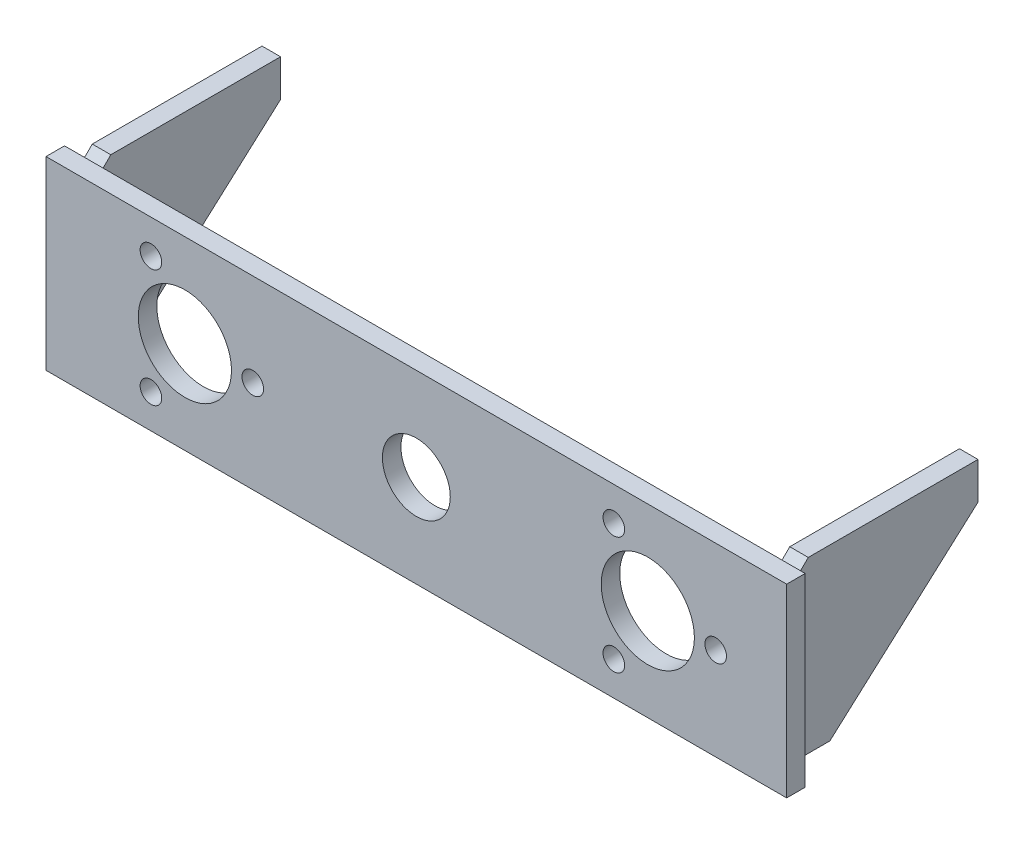
from build123d import *

# Parameters (mm, degrees)
SKETCH1_W          = 240
SKETCH1_H          = 60
BASE_FLANGE1_DEPTH = 6
BASE_FLANGE2_DEPTH = 6
BASE_FLANGE3_DEPTH = 6
SKETCH12_R         = 11
CUT_EXTRUDE1_DEPTH = 141.199857347
SKETCH13_R         = 15.1
CUT_EXTRUDE2_DEPTH = 141.199857347
SKETCH14_R         = 3.5
CUT_EXTRUDE3_DEPTH = 138.477270849
CIRPATTERN1_COUNT  = 3
SKETCH15_R         = 3.5
CUT_EXTRUDE4_DEPTH = 138.477270849
CIRPATTERN2_COUNT  = 3


# Sheet-metal steps are written as plain solids
with BuildPart() as part:
    # Sketch1 → Base-Flange1 (new body)
    with BuildSketch(Plane.XY):
        Rectangle(SKETCH1_W, SKETCH1_H)
    extrude(amount=-BASE_FLANGE1_DEPTH)

    # Sketch12 → Cut-Extrude1 (cut, through all)
    with BuildSketch(Plane.XY):
        Circle(SKETCH12_R)
    extrude(amount=-CUT_EXTRUDE1_DEPTH, mode=Mode.SUBTRACT)

    # Sketch13 → Cut-Extrude2 (cut, through all)
    with BuildSketch(Plane.XY):
        with Locations((-75, 0)):
            Circle(SKETCH13_R)
        with Locations((75, 0)):
            Circle(SKETCH13_R)
    extrude(amount=-CUT_EXTRUDE2_DEPTH, mode=Mode.SUBTRACT)

    # Sketch14 → Cut-Extrude3 (cut, through all)
    with BuildSketch(Plane(origin=(0, 0, -6), x_dir=(-1, 0, 0), z_dir=(0, 0, -1))):
        with Locations((-97, 0)):
            Circle(SKETCH14_R)
    cut_extrude3 = extrude(amount=-CUT_EXTRUDE3_DEPTH, mode=Mode.SUBTRACT)

    # CirPattern1: Cut-Extrude3 ×3 about axis
    cirpattern1_axis = Axis((75, 0, 0), (0, 0, 1))
    for i in range(1, CIRPATTERN1_COUNT):
        add(cut_extrude3.rotate(cirpattern1_axis, i * 360 / CIRPATTERN1_COUNT), mode=Mode.SUBTRACT)

    # Sketch15 → Cut-Extrude4 (cut, through all)
    with BuildSketch(Plane(origin=(0, 0, -6), x_dir=(-1, 0, 0), z_dir=(0, 0, -1))):
        with Locations((53, 0)):
            Circle(SKETCH15_R)
    cut_extrude4 = extrude(amount=-CUT_EXTRUDE4_DEPTH, mode=Mode.SUBTRACT)

    # CirPattern2: Cut-Extrude4 ×3 about axis
    cirpattern2_axis = Axis((-75, 0, 0), (0, 0, 1))
    for i in range(1, CIRPATTERN2_COUNT):
        add(cut_extrude4.rotate(cirpattern2_axis, i * 360 / CIRPATTERN2_COUNT), mode=Mode.SUBTRACT)


with BuildPart() as body_2:
    # Sketch6 → Base-Flange2 (new body)
    with BuildSketch(Plane(origin=(110, 0, 0), x_dir=(0, 0, -1), z_dir=(1, 0, 0))):
        Polygon((11, 30), (66, 30), (66, 18), (18, -25), (6, -25), (6, 25), align=None)
    extrude(amount=BASE_FLANGE2_DEPTH)


with BuildPart() as body_3:
    # Sketch9 → Base-Flange3 (new body)
    with BuildSketch(Plane(origin=(-110, 0, 0), x_dir=(0, 0, -1), z_dir=(1, 0, 0))):
        Polygon((66, 30), (11, 30), (6, 25), (6, -25), (18, -25), (66, 18), align=None)
    extrude(amount=-BASE_FLANGE3_DEPTH)


solid = Compound([part.part, body_2.part, body_3.part])
